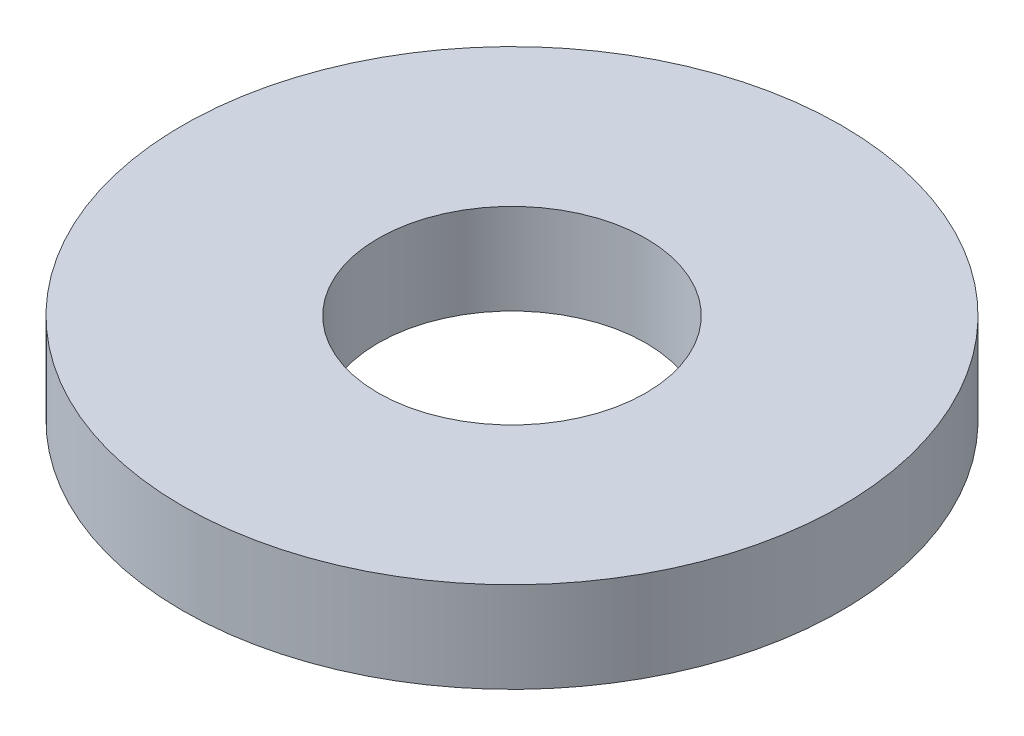
from build123d import *

# Parameters (mm, degrees)
SKETCH1_R           = 80
BOSS_EXTRUDE1_DEPTH = 22
SKETCH2_R           = 32.5
CUT_EXTRUDE1_DEPTH  = 116.256236274


with BuildPart() as part:
    # Sketch1 → Boss-Extrude1 (new body)
    with BuildSketch(Plane(origin=(0, 0, 0), x_dir=(1, 0, 0), z_dir=(0, 1, 0))):
        Circle(SKETCH1_R)
    extrude(amount=BOSS_EXTRUDE1_DEPTH)

    # Sketch2 → Cut-Extrude1 (cut, through all)
    with BuildSketch(Plane(origin=(0, 0, 0), x_dir=(1, 0, 0), z_dir=(0, 1, 0))):
        Circle(SKETCH2_R)
    extrude(amount=CUT_EXTRUDE1_DEPTH, mode=Mode.SUBTRACT)


solid = part.part
